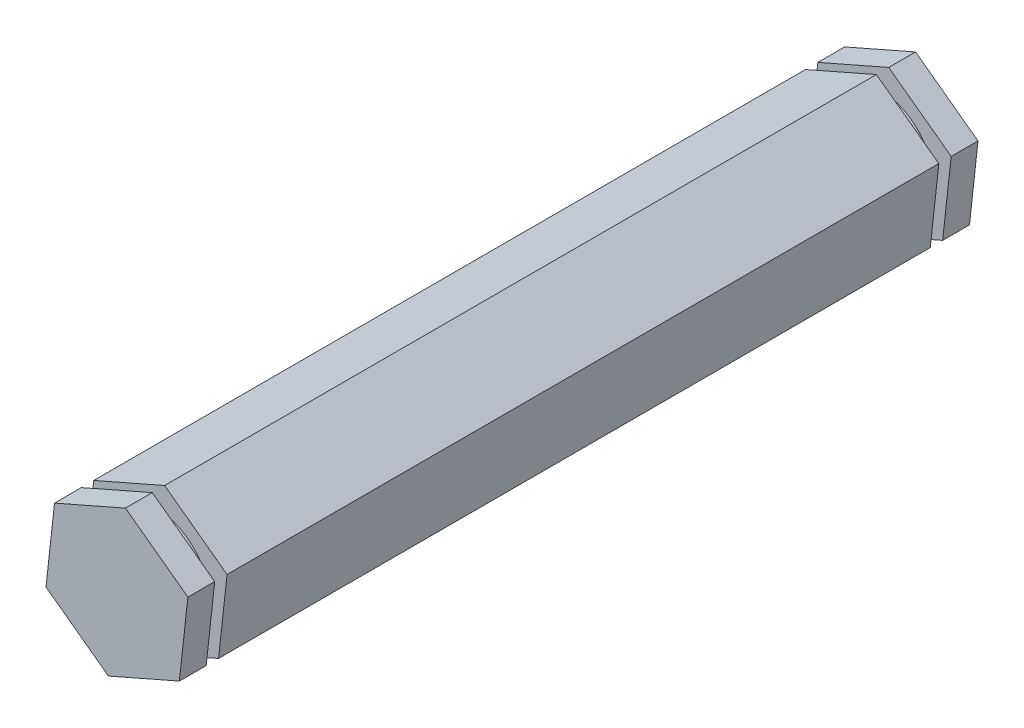
from build123d import *

# Parameters (mm, degrees)
BOSS_EXTRUDE1_DEPTH = 67.3735
SKETCH2_R           = 5.0292
BOSS_EXTRUDE2_DEPTH = 1.1684
BOSS_EXTRUDE3_DEPTH = 2.54
BOSS_EXTRUDE4_START = 1.1684
SKETCH5_R           = 5.0292
BOSS_EXTRUDE4_DEPTH = 1.1684
BOSS_EXTRUDE5_DEPTH = 2.54


with BuildPart() as part:
    # Sketch1 → Boss-Extrude1 (new body)
    with BuildSketch(Plane.XY):
        Polygon((5.908332382, -4.342227746), (6.714645728, 2.945652064), (0.806313346, 7.28787981), (-5.908332382, 4.342227746), (-6.714645728, -2.945652064), (-0.806313346, -7.28787981), align=None)
    extrude(amount=BOSS_EXTRUDE1_DEPTH)

    # Sketch2 → Boss-Extrude2 (add)
    with BuildSketch(Plane.XY.offset(67.3735)):
        Circle(SKETCH2_R)
    extrude(amount=BOSS_EXTRUDE2_DEPTH)

    # Sketch3 → Boss-Extrude3 (add)
    with BuildSketch(Plane.XY.offset(68.5419)):
        Polygon((-0.806313346, -7.28787981), (5.908332382, -4.342227746), (6.714645728, 2.945652064), (0.806313346, 7.28787981), (-5.908332382, 4.342227746), (-6.714645728, -2.945652064), align=None)
    extrude(amount=BOSS_EXTRUDE3_DEPTH)

    # Sketch5 → Boss-Extrude4 (add)
    with BuildSketch(Plane(origin=(0, 0, 0), x_dir=(-1, 0, 0), z_dir=(0, 0, -1)).offset(BOSS_EXTRUDE4_START)):
        Circle(SKETCH5_R)
    extrude(amount=-BOSS_EXTRUDE4_DEPTH)

    # Sketch6 → Boss-Extrude5 (add)
    with BuildSketch(Plane(origin=(0, 0, -1.1684), x_dir=(-1, 0, 0), z_dir=(0, 0, -1))):
        Polygon((-5.908332382, -4.342227746), (0.806313346, -7.28787981), (6.714645728, -2.945652064), (5.908332382, 4.342227746), (-0.806313346, 7.28787981), (-6.714645728, 2.945652064), align=None)
    extrude(amount=BOSS_EXTRUDE5_DEPTH)


solid = part.part
